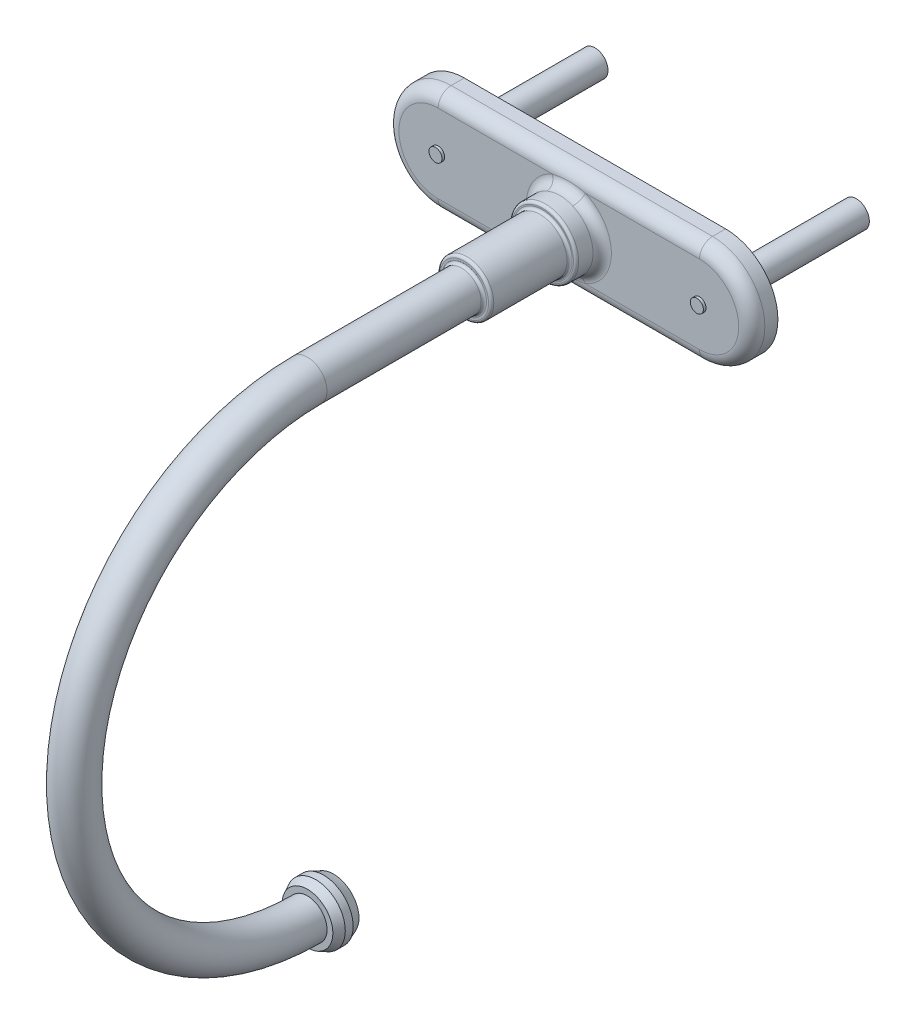
from build123d import *

# Parameters (mm, degrees)
BASE_EXTRUDE_DEPTH  = 10
SKETCH2_R           = 5
SKETCH2_R_2         = 2.5
BOSS_EXTRUDE1_DEPTH = 50
SKETCH4_R           = 7.5
SKETCH4_R_2         = 5
FILLET1_R           = 5
BOSS_EXTRUDE2_START = 10
SKETCH6_R           = 12.781787914
SKETCH6_R_2         = 5
BOSS_EXTRUDE2_DEPTH = 10
BOSS_EXTRUDE3_START = 30
SKETCH7_R           = 10.299904742
SKETCH7_R_2         = 5
BOSS_EXTRUDE3_DEPTH = 30
FILLET3_R           = 1
FILLET4_R           = 3.5
FILLET11_R          = 1
SKETCH8_R           = 9.720772816
SKETCH13_R          = 11.305530655
SKETCH14_R          = 11.305530655
BOSS_EXTRUDE4_DEPTH = 3
SKETCH17_R          = 5
CUT_EXTRUDE1_DEPTH  = 10
BOSS_EXTRUDE5_START = 1
SKETCH16_R          = 2.5
BOSS_EXTRUDE5_DEPTH = 1


with BuildPart() as part:
    # Sketch1 → Base-Extrude (new body)
    with BuildSketch(Plane.XY):
        with BuildLine():
            Line((-50, 20), (50, 20))
            ThreePointArc((50, 20), (70, 0), (50, -20))
            Line((50, -20), (-50, -20))
            ThreePointArc((-50, -20), (-70, 0), (-50, 20))
        make_face()
    extrude(amount=BASE_EXTRUDE_DEPTH)

    # Sketch2 → Boss-Extrude1 (add)
    # profile 1 of 2: a face of its own
    with BuildSketch(Plane(origin=(0, 0, 0), x_dir=(-1, 0, 0), z_dir=(0, 0, -1))):
        with Locations(Location((50, 0, 0), (0, 0, 180))):
            Circle(SKETCH2_R)
        with Locations((50, 0)):
            Circle(SKETCH2_R_2, mode=Mode.SUBTRACT)
    # profile 2 of 2: a face of its own
    with BuildSketch(Plane(origin=(0, 0, 0), x_dir=(-1, 0, 0), z_dir=(0, 0, -1))):
        with Locations(Location((-50, 0, 0), (0, 0, 180))):
            Circle(SKETCH2_R)
        with Locations((-50, 0)):
            Circle(SKETCH2_R_2, mode=Mode.SUBTRACT)
    extrude(amount=BOSS_EXTRUDE1_DEPTH)

    # Boss-Sweep1: sweep along a path in Sketch3
    with BuildLine(Plane(origin=(0, 0, 0), x_dir=(0, 0, -1), z_dir=(1, 0, 0))) as boss_sweep1_path:
        Line((-10, -1.759867214), (-110, -1.759867214))
        ThreePointArc((-110, -1.759867214), (-197.5, -89.259867214), (-110, -176.759867214))
    # Sketch4 → Boss-Sweep1 (sweep)
    with BuildSketch(Plane.XY.offset(10)):
        Circle(SKETCH4_R)
        Circle(SKETCH4_R_2, mode=Mode.SUBTRACT)
    sweep(path=boss_sweep1_path.line)

    # Fillet1
    fillet1_edges = [part.edges().sort_by_distance(p)[0] for p in [
        (70, 0, 10),
        (0, 20, 10),
        (-70, 0, 10),
        (0, -20, 10),
    ]]
    fillet(fillet1_edges, radius=FILLET1_R)

    # Sketch6 → Boss-Extrude2 (add)
    with BuildSketch(Plane.XY.offset(10).offset(BOSS_EXTRUDE2_START)):
        Circle(SKETCH6_R)
        with Locations(Location((0, 0, 0), (0, 0, 90))):
            Circle(SKETCH6_R_2, mode=Mode.SUBTRACT)
    extrude(amount=-BOSS_EXTRUDE2_DEPTH)

    # Sketch7 → Boss-Extrude3 (add)
    with BuildSketch(Plane.XY.offset(20).offset(BOSS_EXTRUDE3_START)):
        Circle(SKETCH7_R)
        with Locations(Location((0, 0, 0), (0, 0, 90))):
            Circle(SKETCH7_R_2, mode=Mode.SUBTRACT)
    extrude(amount=-BOSS_EXTRUDE3_DEPTH)

    # Fillet3
    fillet3_edges = [part.edges().sort_by_distance(p)[0] for p in [
        (-12.781787914, 0, 20),
        (-10.299904742, 0, 20),
    ]]
    fillet(fillet3_edges, radius=FILLET3_R)

    # Fillet4
    fillet4_edges = [part.edges().sort_by_distance(p)[0] for p in [
        (-12.781787914, 0, 10),
    ]]
    fillet(fillet4_edges, radius=FILLET4_R)

    # Fillet11
    fillet11_edges = [part.edges().sort_by_distance(p)[0] for p in [
        (-10.299904742, 0, 50),
        (-7.5, 0, 50),
    ]]
    fillet(fillet11_edges, radius=FILLET11_R)

    # Sketch8 → Boss-Loft2 section 0
    with BuildSketch(Plane(origin=(0, 0, 110), x_dir=(-1, 0, 0), z_dir=(0, 0, -1))):
        with Locations((0, -178.519734428)):
            Circle(SKETCH8_R)
    # Sketch13 → Boss-Loft2 section 1
    with BuildSketch(Plane(origin=(0, 0, 106.825), x_dir=(-1, 0, 0), z_dir=(0, 0, -1))):
        with Locations((0, -178.519734428)):
            Circle(SKETCH13_R)
    loft()

    # Sketch14 → Boss-Extrude4 (add)
    with BuildSketch(Plane(origin=(0, 0, 106.825), x_dir=(-1, 0, 0), z_dir=(0, 0, -1))):
        with Locations(Location((0, -178.519734428, 0), (0, 0, 90))):
            Circle(SKETCH14_R)
    extrude(amount=BOSS_EXTRUDE4_DEPTH)

    # Boss-Loft3: read off the stored shape, not the designer's step
    # Boss-Loft3: loft between two sections, ruled curve by curve
    boss_loft3_from = [
        Edge.make_bspline([(2.597761832, -167.516704989, 103.825), (24.603820711, -172.712228652, 103.825), (19.408297048, -194.718287532, 103.825), (-2.597761832, -189.522763868, 103.825), (-24.603820711, -184.327240205, 103.825), (-19.408297048, -162.321181325, 103.825), (2.597761832, -167.516704989, 103.825)], [0, 0, 0, 0, 0.5, 0.5, 0.5, 1, 1, 1, 1], 3, [1, 0.333333333, 0.333333333, 1, 0.333333333, 0.333333333, 1]),
    ]
    boss_loft3_to = [
        Edge.make_bspline([(4.292995877, -169.79828899, 100), (21.735886755, -178.384280744, 100), (13.149895, -195.827171622, 100), (-4.292995877, -187.241179867, 100), (-21.735886755, -178.655188112, 100), (-13.149895, -161.212297235, 100), (4.292995877, -169.79828899, 100)], [0, 0, 0, 0, 0.5, 0.5, 0.5, 1, 1, 1, 1], 3, [1, 0.333333333, 0.333333333, 1, 0.333333333, 0.333333333, 1]),
    ]
    boss_loft3 = Solid(Shell([*[Face.make_surface_from_curves(boss_loft3_from[k], boss_loft3_to[k]) for k in range(1)], Face(Wire(boss_loft3_from)), Face(Wire(boss_loft3_to))]))
    add(boss_loft3)

    # Sketch17 → Cut-Extrude1 (cut)
    with BuildSketch(Plane(origin=(0, 0, 100), x_dir=(-1, 0, 0), z_dir=(0, 0, -1))):
        with Locations(Location((0, -178.519734428, 0), (0, 0, 90))):
            Circle(SKETCH17_R)
    extrude(amount=-CUT_EXTRUDE1_DEPTH, mode=Mode.SUBTRACT)

    # Sketch16 → Boss-Extrude5 (add)
    with BuildSketch(Plane.XY.offset(10).offset(BOSS_EXTRUDE5_START)):
        with Locations(Location((-50, 0, 0), (0, 0, 180))):
            Circle(SKETCH16_R)
        with Locations(Location((50, 0, 0), (0, 0, 180))):
            Circle(SKETCH16_R)
    extrude(amount=-BOSS_EXTRUDE5_DEPTH)


solid = part.part
